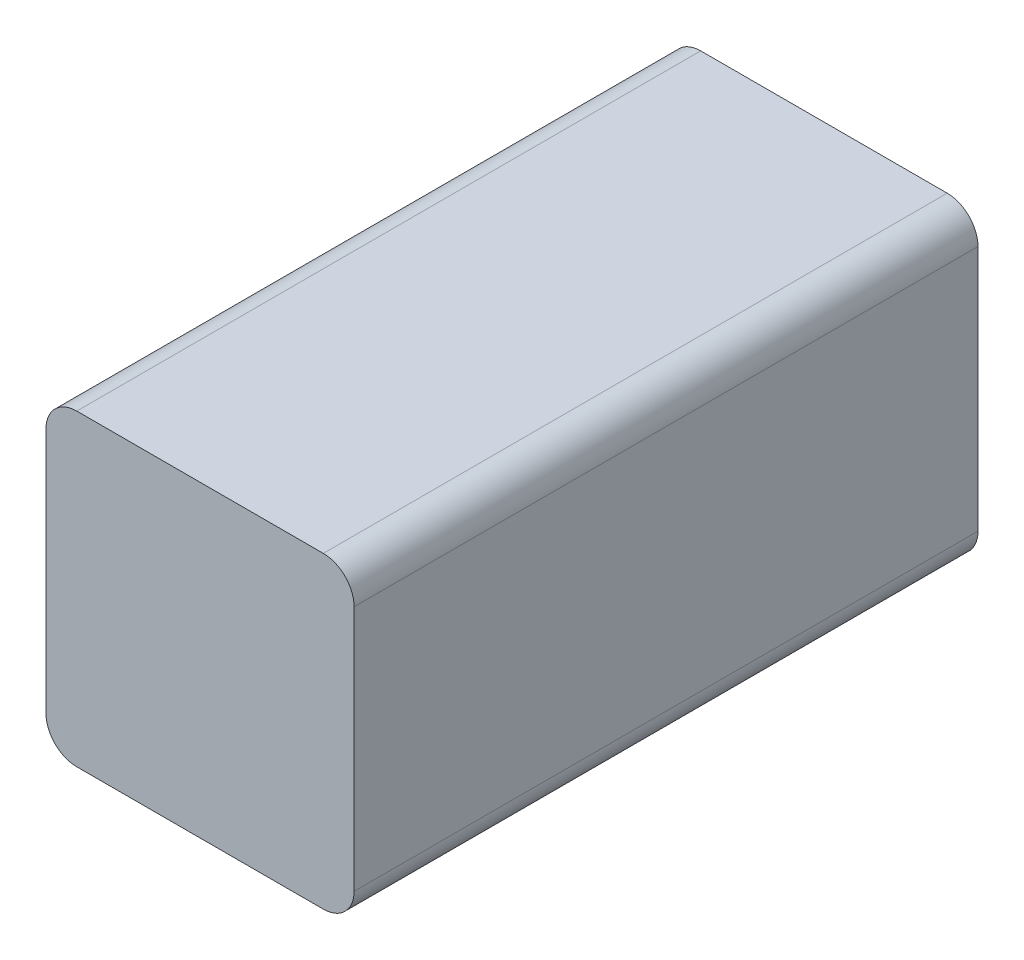
from build123d import *

# Parameters (mm, degrees)
BOSS_EXTRUDE1_DEPTH = 508
SHELL1_T            = -6.35
CUT_EXTRUDE1_REACH  = 540.815
SKETCH3_R           = 34.925
SKETCH5_R           = 6.35
BOSS_EXTRUDE2_DEPTH = 25.4
CHAMFER1_SIZE       = 2.032
SKETCH10_R          = 12.7
CUT_EXTRUDE2_DEPTH  = 114.3
CHAMFER2_SIZE       = 5.08
CHAMFER2_SIZE2      = 7.254991874
BOSS_EXTRUDE3_DEPTH = 6.35


# Read off the part's stored shape, not the designer's step: 1-1/2-6 Machine Threads Stud1
with BuildPart() as part:
    # Sketch2 → Boss-Extrude1 (new body)
    with BuildSketch(Plane.XY):
        with BuildLine():
            Line((-101.6, 127), (101.6, 127))
            ThreePointArc((101.6, 127), (119.560512242, 119.560512242), (127, 101.6))
            Line((127, 101.6), (127, -101.6))
            ThreePointArc((127, -101.6), (119.560512242, -119.560512242), (101.6, -127))
            Line((101.6, -127), (-101.6, -127))
            ThreePointArc((-101.6, -127), (-119.560512242, -119.560512242), (-127, -101.6))
            Line((-127, -101.6), (-127, 101.6))
            ThreePointArc((-127, 101.6), (-119.560512242, 119.560512242), (-101.6, 127))
        make_face()
    extrude(amount=BOSS_EXTRUDE1_DEPTH)

    # Shell1
    shell1_openings = [part.faces().sort_by_distance(p)[0] for p in [
        (0, 0, 508),
    ]]
    offset(amount=SHELL1_T, openings=shell1_openings, kind=Kind.INTERSECTION)

    # Sketch3 → Cut-Extrude1 (cut, up to next)
    with BuildSketch(Plane(origin=(0, 0, 0), x_dir=(-1, 0, 0), z_dir=(0, 0, -1)), mode=Mode.PRIVATE) as cut_extrude1_sk1:
        Circle(SKETCH3_R)
    cut_extrude1_tool1 = extrude(cut_extrude1_sk1.sketch, amount=-CUT_EXTRUDE1_REACH, mode=Mode.PRIVATE) & part.part
    add(cut_extrude1_tool1.solids().sort_by_distance((0, 0, 0))[0], mode=Mode.SUBTRACT)

    # Sketch5 → Boss-Extrude2 (add)
    with BuildSketch(Plane(origin=(0, 0, 0), x_dir=(-1, 0, 0), z_dir=(0, 0, -1))):
        with Locations((-69.596984938, 69.596984938)):
            Circle(SKETCH5_R)
        with Locations((69.596984938, 69.596984938)):
            Circle(SKETCH5_R)
        with Locations((69.596984938, -69.596984938)):
            Circle(SKETCH5_R)
        with Locations((-69.596984938, -69.596984938)):
            Circle(SKETCH5_R)
    extrude(amount=BOSS_EXTRUDE2_DEPTH)

    # Chamfer1
    chamfer1_edges = [part.edges().sort_by_distance(p)[0] for p in [
        (75.946984938, -69.596984938, -25.4),
        (-63.246984938, -69.596984938, -25.4),
        (-63.246984938, 69.596984938, -25.4),
        (75.946984938, 69.596984938, -25.4),
    ]]
    chamfer(chamfer1_edges, length=CHAMFER1_SIZE)

    # Sketch7 → Revolve3 (revolve)
    with BuildSketch(Plane(origin=(0, 0, 0), x_dir=(1, 0, 0), z_dir=(0, 1, 0)), mode=Mode.PRIVATE) as revolve3_sk:
        with BuildLine():
            Line((-60.071984938, 25.4), (-60.071984938, -50.8))
            Line((-60.071984938, -50.8), (-69.596984938, -50.8))
            Line((-69.596984938, -50.8), (-69.596984938, 38.1))
            ThreePointArc((-69.596984938, 38.1), (-60.616728817, 34.380256121), (-56.896984938, 25.4))
            Line((-56.896984938, 25.4), (-60.071984938, 25.4))
        make_face()
    revolve3 = revolve(revolve3_sk.sketch.rotate(Axis((-69.596984938, 0, -42.573078711), (0, 0, 1)), 180), axis=Axis((-69.596984938, 0, -42.573078711), (0, 0, 1)))

    # Mirror1: Revolve3 across plane
    add(revolve3.mirror(Plane(origin=(0, 0, 0), x_dir=(0, 0, 1), z_dir=(1, 0, 0))))

    # Sketch12 → Boss-Extrude3 (add)
    with BuildSketch(Plane.XY.offset(508)):
        with BuildLine():
            Line((-101.6, -127), (101.6, -127))
            ThreePointArc((101.6, -127), (119.560512242, -119.560512242), (127, -101.6))
            Line((127, -101.6), (127, 101.6))
            ThreePointArc((127, 101.6), (119.560512242, 119.560512242), (101.6, 127))
            Line((101.6, 127), (-101.6, 127))
            ThreePointArc((-101.6, 127), (-119.560512242, 119.560512242), (-127, 101.6))
            Line((-127, 101.6), (-127, -101.6))
            ThreePointArc((-127, -101.6), (-119.560512242, -119.560512242), (-101.6, -127))
        make_face()
    extrude(amount=BOSS_EXTRUDE3_DEPTH)


with BuildPart() as body_2:
    # Sketch9 → Revolve4 (revolve)
    with BuildSketch(Plane(origin=(0, 0, 0), x_dir=(1, 0, 0), z_dir=(0, 1, 0))):
        Polygon((0, 22.225), (19.05, 22.225), (19.05, -53.975), (25.4, -53.975), (25.4, -101.6), (0, -101.6), align=None)
    revolve(axis=Axis((0, 0, 101.6), (0, 0, -1)))

    # Sketch10 → Cut-Extrude2 (cut)
    with BuildSketch(Plane(origin=(0, 0, -22.225), x_dir=(-1, 0, 0), z_dir=(0, 0, -1))):
        Circle(SKETCH10_R)
    extrude(amount=-CUT_EXTRUDE2_DEPTH, mode=Mode.SUBTRACT)

    # Chamfer2
    chamfer2_edges = [body_2.edges().sort_by_distance(p)[0] for p in [
        (12.7, 0, -22.225),
    ]]
    chamfer2_side = [body_2.faces().sort_by_distance(p)[0] for p in [
        (-18.511184633, 0, -22.225),
    ]]
    chamfer(chamfer2_edges, length=CHAMFER2_SIZE, length2=CHAMFER2_SIZE2, reference=chamfer2_side[0])

    # 1-1/2-6 Machine Threads Stud1 outline → 1-1/2-6 Machine Threads Stud1 (revolve, cut)
    with BuildSketch(Plane.XZ):
        Polygon((17.265336151, -21.489983849), (17.265336151, -22.225), (19.05, -22.225), (19.05, -19.70532), align=None)
    revolve(axis=Axis((0, 0, 0), (0, 0, 1)), mode=Mode.SUBTRACT)


solid = Compound([part.part, body_2.part])
